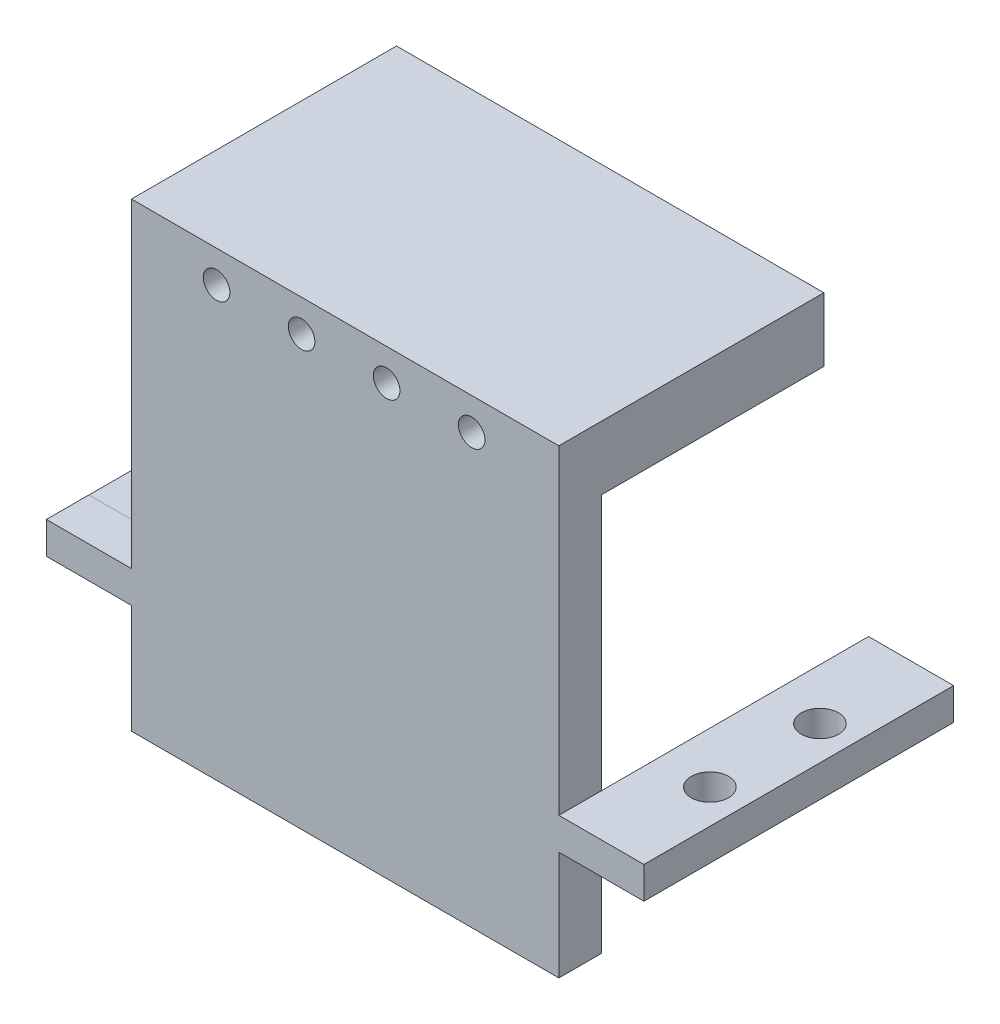
from build123d import *

# Parameters (mm, degrees)
BOSS_EXTRUDE2_DEPTH      = 4
BOSS_EXTRUDE3_DEPTH      = 25.13
SKETCH7_W                = 8
SKETCH7_H                = 3
BOSS_EXTRUDE4_DEPTH      = 25.13
SKETCH32_W               = 40.2
SKETCH32_H               = 6
BOSS_EXTRUDE6_DEPTH      = 20.93
SKETCH70_R               = 1.75
CUT_EXTRUDE23_DEPTH      = 5
SKETCH71_R               = 1.75
CUT_EXTRUDE24_DEPTH      = 6
CUT_EXTRUDE26_DEPTH      = 10
CUT_EXTRUDE26_DEPTH_BACK = 25
SKETCH86_R               = 1.25
SKETCH88_W               = 40.2
SKETCH88_H               = 4
BOSS_EXTRUDE26_DEPTH     = 6
CUT_EXTRUDE28_DEPTH      = 4
CUT_EXTRUDE28_DEPTH_BACK = 30
SKETCH89_R               = 1.25


with BuildPart() as part:
    # Sketch5 → Boss-Extrude2 (new body)
    with BuildSketch(Plane.XY):
        Polygon((-138.644230049, -41.159116495), (-138.644230049, -51.409116495), (-98.444230049, -51.409116495), (-98.444230049, -41.159116495), (-90.444230049, -41.159116495), (-90.444230049, -38.159116495), (-98.444230049, -38.159116495), (-98.444230049, -14.059116495), (-138.644230049, -14.059116495), (-138.644230049, -38.159116495), (-146.644230049, -38.159116495), (-146.644230049, -41.159116495), align=None)
    extrude(amount=BOSS_EXTRUDE2_DEPTH)

    # Sketch6 → Boss-Extrude3 (add)
    with BuildSketch(Plane(origin=(0, 0, 0), x_dir=(-1, 0, 0), z_dir=(0, 0, -1))):
        Polygon((146.644230049, -38.165572531), (138.644230049, -38.159116495), (138.644230049, -41.159116495), (146.644230049, -41.159116495), align=None)
    extrude(amount=BOSS_EXTRUDE3_DEPTH)

    # Sketch7 → Boss-Extrude4 (add)
    with BuildSketch(Plane(origin=(0, 0, 0), x_dir=(-1, 0, 0), z_dir=(0, 0, -1))):
        with Locations((94.444230049, -39.659116495)):
            Rectangle(SKETCH7_W, SKETCH7_H)
    extrude(amount=BOSS_EXTRUDE4_DEPTH)

    # Sketch70 → Cut-Extrude23 (cut)
    with BuildSketch(Plane(origin=(0, -38.159116495, 0), x_dir=(1, 0, 0), z_dir=(0, 1, 0))):
        with Locations((-93.644230062, 15.755)):
            Circle(SKETCH70_R)
        with Locations((-93.644230062, 5.405)):
            Circle(SKETCH70_R)
    extrude(amount=-CUT_EXTRUDE23_DEPTH, mode=Mode.SUBTRACT)

    # Sketch71 → Cut-Extrude24 (cut)
    with BuildSketch(Plane(origin=(0, -41.159116495, 0), x_dir=(-1, 0, 0), z_dir=(0, -1, 0))):
        with Locations((143.444230049, 15.755)):
            Circle(SKETCH71_R)
        with Locations((143.444230049, 5.405)):
            Circle(SKETCH71_R)
    extrude(amount=-CUT_EXTRUDE24_DEPTH, mode=Mode.SUBTRACT)



with BuildPart() as body_2:
    # Sketch32 → Boss-Extrude6 (new body)
    with BuildSketch(Plane(origin=(0, 0, 0), x_dir=(-1, 0, 0), z_dir=(0, 0, -1))):
        with Locations((118.544230049, -11.059116495)):
            Rectangle(SKETCH32_W, SKETCH32_H)
    extrude(amount=BOSS_EXTRUDE6_DEPTH)

    # Sketch86 → Cut-Extrude26 (cut, two sides: drawn at the far end of the back side and taken through both)
    with BuildSketch(Plane(origin=(0, 0, -20.93), x_dir=(-1, 0, 0), z_dir=(0, 0, -1)).offset(-CUT_EXTRUDE26_DEPTH_BACK)):
        with Locations((122.644230049, -11.0591165)):
            Circle(SKETCH86_R)
        with Locations((114.644230049, -11.0591165)):
            Circle(SKETCH86_R)
        with Locations((106.644230049, -11.0591165)):
            Circle(SKETCH86_R)
    extrude(amount=CUT_EXTRUDE26_DEPTH + CUT_EXTRUDE26_DEPTH_BACK, mode=Mode.SUBTRACT)


with BuildPart() as part_1:
    add(part.part)

    add(body_2.part)  # Boss-Extrude26 merges body 2
    # Sketch88 → Boss-Extrude26 (add)
    with BuildSketch(Plane(origin=(0, -14.059116495, 0), x_dir=(1, 0, 0), z_dir=(0, 1, 0))):
        with Locations((-118.544230049, -2)):
            Rectangle(SKETCH88_W, SKETCH88_H)
    extrude(amount=BOSS_EXTRUDE26_DEPTH)

    # Sketch89 → Cut-Extrude28 (cut, two sides: drawn at the far end of the back side and taken through both)
    with BuildSketch(Plane.XY.offset(4).offset(-CUT_EXTRUDE28_DEPTH_BACK)):
        with Locations((-130.636250743, -11.059116495)):
            Circle(SKETCH89_R)
        with Locations((-122.644230049, -11.059116495)):
            Circle(SKETCH89_R)
        with Locations((-114.644230049, -11.059116495)):
            Circle(SKETCH89_R)
        with Locations((-106.644230049, -11.059116495)):
            Circle(SKETCH89_R)
    extrude(amount=CUT_EXTRUDE28_DEPTH + CUT_EXTRUDE28_DEPTH_BACK, mode=Mode.SUBTRACT)


solid = part_1.part
